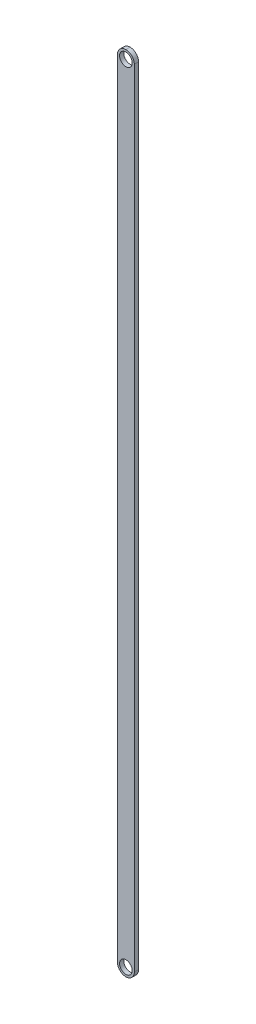
from build123d import *

# Parameters (mm, degrees)
SKETCH1_W           = 2
SKETCH1_H           = 95
SKETCH1_R           = 0.75
BOSS_EXTRUDE1_DEPTH = 0.5
FILLET1_R           = 1


with BuildPart() as part:
    # Sketch1 → Boss-Extrude1 (new body)
    with BuildSketch(Plane.XY):
        Rectangle(SKETCH1_W, SKETCH1_H)
        with Locations((0, -46.5)):
            Circle(SKETCH1_R, mode=Mode.SUBTRACT)
        with Locations((0, 46.5)):
            Circle(SKETCH1_R, mode=Mode.SUBTRACT)
    extrude(amount=BOSS_EXTRUDE1_DEPTH)

    # Fillet1
    fillet1_edges = [part.edges().sort_by_distance(p)[0] for p in [
        (1, -47.5, 0.25),
        (-1, -47.5, 0.25),
        (-1, 47.5, 0.25),
        (1, 47.5, 0.25),
    ]]
    fillet(fillet1_edges, radius=FILLET1_R - 0.0001)  # a hair under: the kernel refuses the full size


solid = part.part
